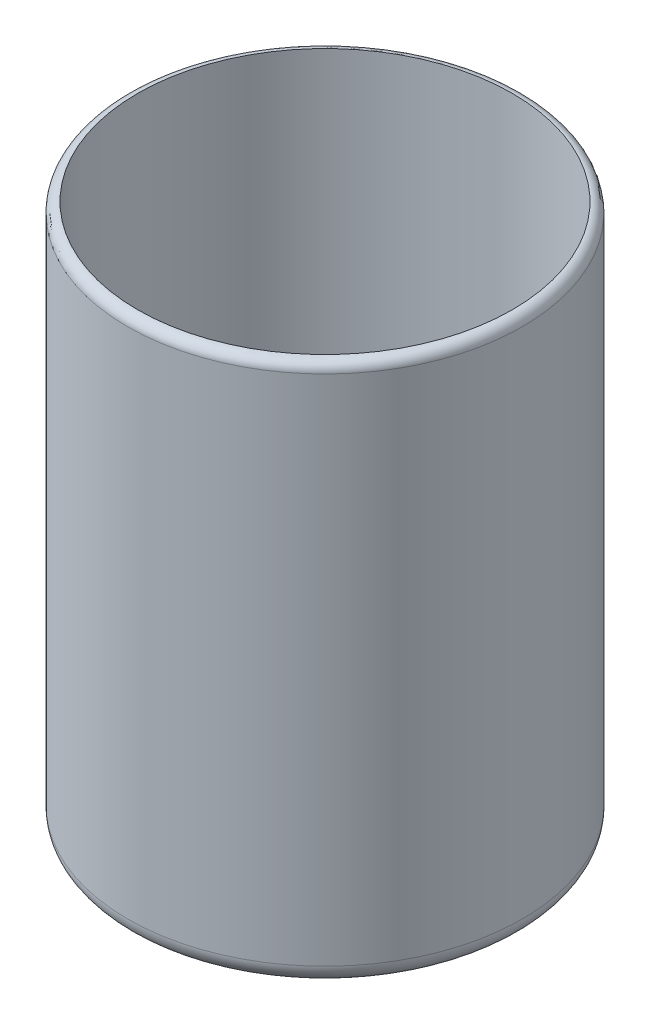
from build123d import *

# Parameters (mm, degrees)
SKETCH1_R           = 20
BOSS_EXTRUDE1_DEPTH = 55
SHELL1_T            = -1
FILLET1_R           = 2
FILLET7_R           = 1


with BuildPart() as part:
    # Sketch1 → Boss-Extrude1 (new body)
    with BuildSketch(Plane(origin=(0, 0, 0), x_dir=(1, 0, 0), z_dir=(0, 1, 0))):
        with Locations(Location((0, 0, 0), (0, 0, 270))):
            Circle(SKETCH1_R)
    extrude(amount=BOSS_EXTRUDE1_DEPTH)

    # Shell1
    shell1_openings = [part.faces().sort_by_distance(p)[0] for p in [
        (0, 55, 0),
    ]]
    offset(amount=SHELL1_T, openings=shell1_openings, kind=Kind.INTERSECTION)

    # Fillet1
    fillet1_edges = [part.edges().sort_by_distance(p)[0] for p in [
        (0, 0, -20),
    ]]
    fillet(fillet1_edges, radius=FILLET1_R)

    # Fillet7
    fillet7_edges = [part.edges().sort_by_distance(p)[0] for p in [
        (0, 55, -20),
    ]]
    fillet(fillet7_edges, radius=FILLET7_R - 0.0001)  # a hair under: the kernel refuses the full size


solid = part.part
